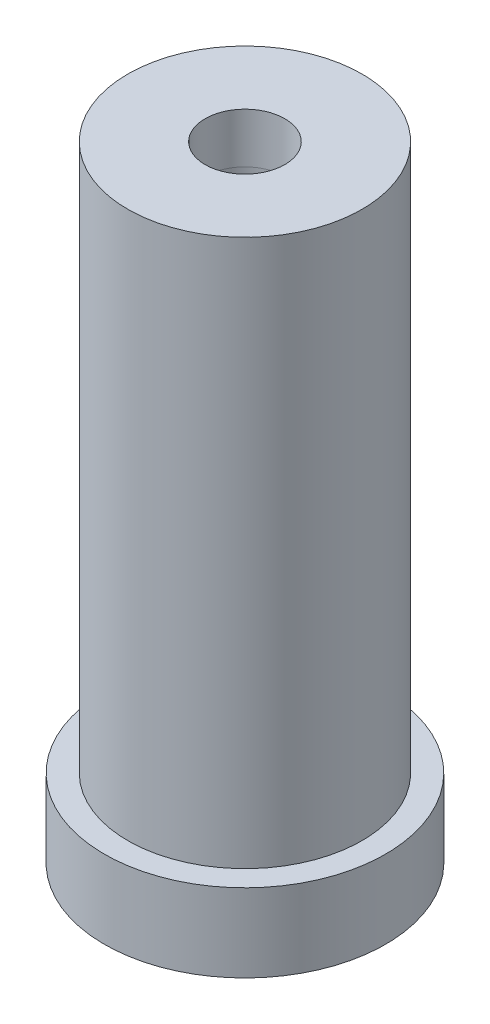
from build123d import *

# Parameters (mm, degrees)
CUT_EXTRUDE1_REACH = 43.976
SKETCH2_R          = 2.55


with BuildPart() as part:
    # Sketch1 → Revolve1 (revolve)
    with BuildSketch(Plane.XY):
        Polygon((0, 0), (9, 0), (9, 5), (7.5, 5), (7.5, 40), (0, 40), align=None)
    revolve(axis=Axis((0, 45, 0), (0, -1, 0)))

    # Sketch2 → Cut-Extrude1 (cut, up to next)
    with BuildSketch(Plane(origin=(0, 40, 0), x_dir=(1, 0, 0), z_dir=(0, 1, 0)), mode=Mode.PRIVATE) as cut_extrude1_sk1:
        Circle(SKETCH2_R)
    cut_extrude1_tool1 = extrude(cut_extrude1_sk1.sketch, amount=-CUT_EXTRUDE1_REACH, mode=Mode.PRIVATE) & part.part
    add(cut_extrude1_tool1.solids().sort_by_distance((0, 40, 0))[0], mode=Mode.SUBTRACT)

    # Cut-Sweep1: sweep along a curve in space
    with BuildLine() as cut_sweep1_path:
        ThreePointArc((0, 40, 2.55), (1.803122292, 40, 1.803122292), (2.55, 40, 0))
        ThreePointArc((2.55, 40, 0), (1.803122292, 40, -1.803122292), (0, 40, -2.55))
        ThreePointArc((0, 40, -2.55), (-1.803122292, 40, -1.803122292), (-2.55, 40, 0))
        ThreePointArc((-2.55, 40, 0), (-1.803122292, 40, 1.803122292), (0, 40, 2.55))
    # Sketch3 → Cut-Sweep1 (sweep, cut)
    with BuildSketch(Plane.XY):
        Polygon((2.55, 36.8), (3.513641914, 0), (2.55, 0), align=None)
    sweep(path=cut_sweep1_path.line, mode=Mode.SUBTRACT)


solid = part.part
